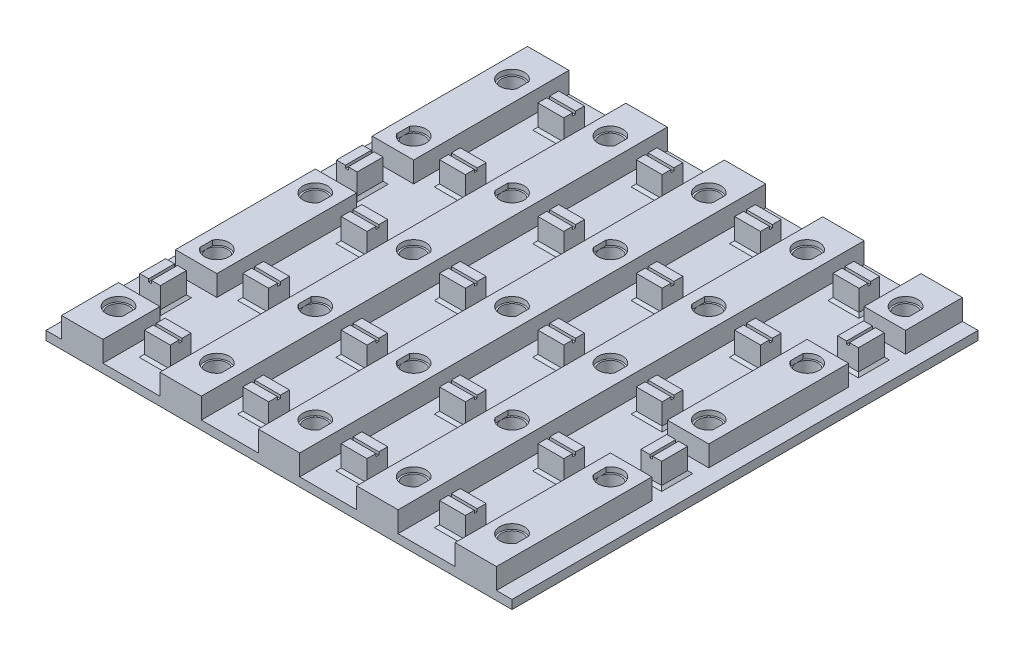
from build123d import *

# Parameters (mm, degrees)
SKETCH1_W            = 220
SKETCH1_H            = 220
BOSS_EXTRUDE1_DEPTH  = 11.4
SKETCH2_R            = 4.075
CUT_EXTRUDE1_DEPTH   = 11.5
CUT_EXTRUDE7_DEPTH   = 1.9
LPATTERN2_COUNT      = 5
LPATTERN2_PITCH      = 38
SKETCH11_W           = 22
SKETCH11_H           = 220
SKETCH11_W_2         = 10
SKETCH11_H_2         = 8
SKETCH11_W_3         = 26
CUT_EXTRUDE8_DEPTH   = 8
SKETCH12_W           = 10
SKETCH12_H           = 3.45
BOSS_EXTRUDE4_DEPTH  = 1.1
LPATTERN3_COUNT      = 5
LPATTERN3_PITCH      = 38
LPATTERN3_COUNT_DIR2 = 4
LPATTERN3_PITCH_DIR2 = 38
SKETCH14_W           = 16
SKETCH14_H           = 22
SKETCH14_W_2         = 8
SKETCH14_H_2         = 10
CUT_EXTRUDE9_DEPTH   = 8
SKETCH16_W           = 3.45
SKETCH16_H           = 10
BOSS_EXTRUDE5_DEPTH  = 1.1
CHAMFER3_SIZE        = 1
SKETCH17_W           = 20
SKETCH17_H           = 220
CUT_EXTRUDE10_DEPTH  = 156.829425976
SKETCH18_W           = 180
SKETCH18_H           = 20
CUT_EXTRUDE11_DEPTH  = 143.583168712


with BuildPart() as part:
    # Sketch1 → Boss-Extrude1 (new body)
    with BuildSketch(Plane(origin=(0, 0, 0), x_dir=(1, 0, 0), z_dir=(0, 1, 0))):
        Rectangle(SKETCH1_W, SKETCH1_H)
    extrude(amount=BOSS_EXTRUDE1_DEPTH)

    # Sketch2 → Cut-Extrude1 (cut)
    with BuildSketch(Plane(origin=(0, 11.4, 0), x_dir=(1, 0, 0), z_dir=(0, 1, 0))):
        with Locations(Location((-76, -76, 0), (0, 0, 270))):
            Circle(SKETCH2_R)
        with Locations(Location((-38, -76, 0), (0, 0, 270))):
            Circle(SKETCH2_R)
        with Locations(Location((0, -76, 0), (0, 0, 270))):
            Circle(SKETCH2_R)
        with Locations(Location((38, -76, 0), (0, 0, 270))):
            Circle(SKETCH2_R)
        with Locations(Location((76, -76, 0), (0, 0, 270))):
            Circle(SKETCH2_R)
        with Locations(Location((-76, -38, 0), (0, 0, 270))):
            Circle(SKETCH2_R)
        with Locations(Location((-38, -38, 0), (0, 0, 270))):
            Circle(SKETCH2_R)
        with Locations(Location((0, -38, 0), (0, 0, 270))):
            Circle(SKETCH2_R)
        with Locations(Location((38, -38, 0), (0, 0, 270))):
            Circle(SKETCH2_R)
        with Locations(Location((76, -38, 0), (0, 0, 270))):
            Circle(SKETCH2_R)
        with Locations(Location((-76, 0, 0), (0, 0, 270))):
            Circle(SKETCH2_R)
        with Locations(Location((-38, 0, 0), (0, 0, 270))):
            Circle(SKETCH2_R)
        with Locations(Location((0, 0, 0), (0, 0, 270))):
            Circle(SKETCH2_R)
        with Locations(Location((38, 0, 0), (0, 0, 270))):
            Circle(SKETCH2_R)
        with Locations(Location((76, 0, 0), (0, 0, 270))):
            Circle(SKETCH2_R)
        with Locations(Location((-76, 38, 0), (0, 0, 270))):
            Circle(SKETCH2_R)
        with Locations(Location((-38, 38, 0), (0, 0, 270))):
            Circle(SKETCH2_R)
        with Locations(Location((0, 38, 0), (0, 0, 270))):
            Circle(SKETCH2_R)
        with Locations(Location((38, 38, 0), (0, 0, 270))):
            Circle(SKETCH2_R)
        with Locations(Location((76, 38, 0), (0, 0, 270))):
            Circle(SKETCH2_R)
        with Locations(Location((-76, 76, 0), (0, 0, 270))):
            Circle(SKETCH2_R)
        with Locations(Location((-38, 76, 0), (0, 0, 270))):
            Circle(SKETCH2_R)
        with Locations(Location((0, 76, 0), (0, 0, 270))):
            Circle(SKETCH2_R)
        with Locations(Location((38, 76, 0), (0, 0, 270))):
            Circle(SKETCH2_R)
        with Locations(Location((76, 76, 0), (0, 0, 270))):
            Circle(SKETCH2_R)
    extrude(amount=-CUT_EXTRUDE1_DEPTH, mode=Mode.SUBTRACT)

    # Sketch10 → Cut-Extrude7 (cut)
    with BuildSketch(Plane(origin=(0, 11.4, 0), x_dir=(1, 0, 0), z_dir=(0, 1, 0))):
        with BuildLine():
            Line((-71.925, -78.440671014), (-71.925, -73.559328986))
            ThreePointArc((-71.925, -73.559328986), (-80.75, -76), (-71.925, -78.440671014))
        make_face()
        with BuildLine():
            Line((-71.925, -2.440671014), (-71.925, 2.440671014))
            ThreePointArc((-71.925, 2.440671014), (-80.75, 0), (-71.925, -2.440671014))
        make_face()
        with BuildLine():
            Line((-71.925, 73.559328986), (-71.925, 78.440671014))
            ThreePointArc((-71.925, 78.440671014), (-80.75, 76), (-71.925, 73.559328986))
        make_face()
        with BuildLine():
            Line((-80.075, -35.559328986), (-80.075, -40.440671014))
            ThreePointArc((-80.075, -40.440671014), (-71.25, -38), (-80.075, -35.559328986))
        make_face()
        with BuildLine():
            Line((-80.075, 40.440671014), (-80.075, 35.559328986))
            ThreePointArc((-80.075, 35.559328986), (-71.25, 38), (-80.075, 40.440671014))
        make_face()
    cut_extrude7 = extrude(amount=-CUT_EXTRUDE7_DEPTH, mode=Mode.SUBTRACT)

    # LPattern2: Cut-Extrude7 ×5
    with Locations(*[(i * LPATTERN2_PITCH, 0, 0) for i in range(1, LPATTERN2_COUNT)]):
        add(cut_extrude7, mode=Mode.SUBTRACT)

    # Sketch11 → Cut-Extrude8 (cut)
    # profile 1 of 6: a face of its own
    with BuildSketch(Plane(origin=(0, 11.4, 0), x_dir=(1, 0, 0), z_dir=(0, 1, 0))):
        with Locations((-57, 0)):
            Rectangle(SKETCH11_W, SKETCH11_H)
        with Locations((-57, -76)):
            Rectangle(SKETCH11_W_2, SKETCH11_H_2, mode=Mode.SUBTRACT)
        with Locations((-57, -38)):
            Rectangle(SKETCH11_W_2, SKETCH11_H_2, mode=Mode.SUBTRACT)
        with Locations((-57, 0)):
            Rectangle(SKETCH11_W_2, SKETCH11_H_2, mode=Mode.SUBTRACT)
        with Locations((-57, 38)):
            Rectangle(SKETCH11_W_2, SKETCH11_H_2, mode=Mode.SUBTRACT)
        with Locations((-57, 76)):
            Rectangle(SKETCH11_W_2, SKETCH11_H_2, mode=Mode.SUBTRACT)
    # profile 2 of 6: a face of its own
    with BuildSketch(Plane(origin=(0, 11.4, 0), x_dir=(1, 0, 0), z_dir=(0, 1, 0))):
        with Locations((-19, 0)):
            Rectangle(SKETCH11_W, SKETCH11_H)
        with Locations((-19, -76)):
            Rectangle(SKETCH11_W_2, SKETCH11_H_2, mode=Mode.SUBTRACT)
        with Locations((-19, -38)):
            Rectangle(SKETCH11_W_2, SKETCH11_H_2, mode=Mode.SUBTRACT)
        with Locations((-19, 0)):
            Rectangle(SKETCH11_W_2, SKETCH11_H_2, mode=Mode.SUBTRACT)
        with Locations((-19, 38)):
            Rectangle(SKETCH11_W_2, SKETCH11_H_2, mode=Mode.SUBTRACT)
        with Locations((-19, 76)):
            Rectangle(SKETCH11_W_2, SKETCH11_H_2, mode=Mode.SUBTRACT)
    # profile 3 of 6: a face of its own
    with BuildSketch(Plane(origin=(0, 11.4, 0), x_dir=(1, 0, 0), z_dir=(0, 1, 0))):
        with Locations((19, 0)):
            Rectangle(SKETCH11_W, SKETCH11_H)
        with Locations((19, -76)):
            Rectangle(SKETCH11_W_2, SKETCH11_H_2, mode=Mode.SUBTRACT)
        with Locations((19, -38)):
            Rectangle(SKETCH11_W_2, SKETCH11_H_2, mode=Mode.SUBTRACT)
        with Locations((19, 0)):
            Rectangle(SKETCH11_W_2, SKETCH11_H_2, mode=Mode.SUBTRACT)
        with Locations((19, 38)):
            Rectangle(SKETCH11_W_2, SKETCH11_H_2, mode=Mode.SUBTRACT)
        with Locations((19, 76)):
            Rectangle(SKETCH11_W_2, SKETCH11_H_2, mode=Mode.SUBTRACT)
    # profile 4 of 6: a face of its own
    with BuildSketch(Plane(origin=(0, 11.4, 0), x_dir=(1, 0, 0), z_dir=(0, 1, 0))):
        with Locations((57, 0)):
            Rectangle(SKETCH11_W, SKETCH11_H)
        with Locations((57, -76)):
            Rectangle(SKETCH11_W_2, SKETCH11_H_2, mode=Mode.SUBTRACT)
        with Locations((57, -38)):
            Rectangle(SKETCH11_W_2, SKETCH11_H_2, mode=Mode.SUBTRACT)
        with Locations((57, 0)):
            Rectangle(SKETCH11_W_2, SKETCH11_H_2, mode=Mode.SUBTRACT)
        with Locations((57, 38)):
            Rectangle(SKETCH11_W_2, SKETCH11_H_2, mode=Mode.SUBTRACT)
        with Locations((57, 76)):
            Rectangle(SKETCH11_W_2, SKETCH11_H_2, mode=Mode.SUBTRACT)
    # profile 5 of 6: a face of its own
    with BuildSketch(Plane(origin=(0, 11.4, 0), x_dir=(1, 0, 0), z_dir=(0, 1, 0))):
        with Locations((-97, 0)):
            Rectangle(SKETCH11_W_3, SKETCH11_H)
    # profile 6 of 6: a face of its own
    with BuildSketch(Plane(origin=(0, 11.4, 0), x_dir=(1, 0, 0), z_dir=(0, 1, 0))):
        with Locations((97, 0)):
            Rectangle(SKETCH11_W_3, SKETCH11_H)
    extrude(amount=-CUT_EXTRUDE8_DEPTH, mode=Mode.SUBTRACT)

    # Sketch12 → Boss-Extrude4 (add)
    with BuildSketch(Plane(origin=(0, 11.4, 0), x_dir=(1, 0, 0), z_dir=(0, 1, 0))):
        with Locations((57, -73.725)):
            Rectangle(SKETCH12_W, SKETCH12_H)
        with Locations((57, -78.275)):
            Rectangle(SKETCH12_W, SKETCH12_H)
    boss_extrude4 = extrude(amount=BOSS_EXTRUDE4_DEPTH)

    # LPattern3: Boss-Extrude4 5 × 4
    with Locations(*[(-j * LPATTERN3_PITCH_DIR2, 0, -i * LPATTERN3_PITCH) for i in range(LPATTERN3_COUNT) for j in range(LPATTERN3_COUNT_DIR2) if (i, j) != (0, 0)]):
        add(boss_extrude4)

    # Sketch14 → Cut-Extrude9 (cut)
    # profile 1 of 4: a face of its own
    with BuildSketch(Plane(origin=(0, 11.4, 0), x_dir=(1, 0, 0), z_dir=(0, 1, 0))):
        with Locations((76, 57)):
            Rectangle(SKETCH14_W, SKETCH14_H)
        with Locations((77.8, 57)):
            Rectangle(SKETCH14_W_2, SKETCH14_H_2, mode=Mode.SUBTRACT)
    # profile 2 of 4: a face of its own
    with BuildSketch(Plane(origin=(0, 11.4, 0), x_dir=(1, 0, 0), z_dir=(0, 1, 0))):
        with Locations((-76, 19)):
            Rectangle(SKETCH14_W, SKETCH14_H)
        with Locations((-77.8, 19)):
            Rectangle(SKETCH14_W_2, SKETCH14_H_2, mode=Mode.SUBTRACT)
    # profile 3 of 4: a face of its own
    with BuildSketch(Plane(origin=(0, 11.4, 0), x_dir=(1, 0, 0), z_dir=(0, 1, 0))):
        with Locations((76, -19)):
            Rectangle(SKETCH14_W, SKETCH14_H)
        with Locations((77.8, -19)):
            Rectangle(SKETCH14_W_2, SKETCH14_H_2, mode=Mode.SUBTRACT)
    # profile 4 of 4: a face of its own
    with BuildSketch(Plane(origin=(0, 11.4, 0), x_dir=(1, 0, 0), z_dir=(0, 1, 0))):
        with Locations((-76, -57)):
            Rectangle(SKETCH14_W, SKETCH14_H)
        with Locations((-77.8, -57)):
            Rectangle(SKETCH14_W_2, SKETCH14_H_2, mode=Mode.SUBTRACT)
    extrude(amount=-CUT_EXTRUDE9_DEPTH, mode=Mode.SUBTRACT)

    # Sketch16 → Boss-Extrude5 (add)
    with BuildSketch(Plane(origin=(0, 11.4, 0), x_dir=(1, 0, 0), z_dir=(0, 1, 0))):
        with Locations((75.525, 57)):
            Rectangle(SKETCH16_W, SKETCH16_H)
        with Locations((80.075, 57)):
            Rectangle(SKETCH16_W, SKETCH16_H)
        with Locations((-80.075, 19)):
            Rectangle(SKETCH16_W, SKETCH16_H)
        with Locations((-75.525, 19)):
            Rectangle(SKETCH16_W, SKETCH16_H)
        with Locations((75.525, -19)):
            Rectangle(SKETCH16_W, SKETCH16_H)
        with Locations((80.075, -19)):
            Rectangle(SKETCH16_W, SKETCH16_H)
        with Locations((-80.075, -57)):
            Rectangle(SKETCH16_W, SKETCH16_H)
        with Locations((-75.525, -57)):
            Rectangle(SKETCH16_W, SKETCH16_H)
    extrude(amount=BOSS_EXTRUDE5_DEPTH)

    # Chamfer3
    chamfer3_edges = [part.edges().sort_by_distance(p)[0] for p in [
        (77.8, 3.4, -62),
        (73.8, 3.4, -57),
        (77.8, 3.4, -52),
        (81.8, 3.4, -57),
        (-77.8, 3.4, -24),
        (-81.8, 3.4, -19),
        (-77.8, 3.4, -14),
        (-73.8, 3.4, -19),
        (77.8, 3.4, 14),
        (73.8, 3.4, 19),
        (77.8, 3.4, 24),
        (81.8, 3.4, 19),
        (-77.8, 3.4, 52),
        (-81.8, 3.4, 57),
        (-77.8, 3.4, 62),
        (-73.8, 3.4, 57),
        (-19, 3.4, -80),
        (-19, 3.4, -42),
        (-19, 3.4, -4),
        (-19, 3.4, 34),
        (-19, 3.4, 72),
        (-14, 3.4, -76),
        (-14, 3.4, -38),
        (-14, 3.4, 0),
        (-14, 3.4, 38),
        (-14, 3.4, 76),
        (-24, 3.4, 76),
        (-19, 3.4, 80),
        (-24, 3.4, 38),
        (-19, 3.4, 42),
        (-24, 3.4, 0),
        (-19, 3.4, 4),
        (-24, 3.4, -38),
        (-19, 3.4, -34),
        (-24, 3.4, -76),
        (-19, 3.4, -72),
        (19, 3.4, -80),
        (19, 3.4, -42),
        (19, 3.4, -4),
        (19, 3.4, 34),
        (19, 3.4, 72),
        (24, 3.4, -76),
        (24, 3.4, -38),
        (24, 3.4, 0),
        (24, 3.4, 38),
        (24, 3.4, 76),
        (14, 3.4, 76),
        (19, 3.4, 80),
        (14, 3.4, 38),
        (19, 3.4, 42),
        (14, 3.4, 0),
        (19, 3.4, 4),
        (14, 3.4, -38),
        (19, 3.4, -34),
        (14, 3.4, -76),
        (19, 3.4, -72),
        (57, 3.4, -80),
        (57, 3.4, -42),
        (57, 3.4, -4),
        (57, 3.4, 34),
        (57, 3.4, 72),
        (62, 3.4, -76),
        (62, 3.4, -38),
        (62, 3.4, 0),
        (62, 3.4, 38),
        (62, 3.4, 76),
        (52, 3.4, 76),
        (57, 3.4, 80),
        (52, 3.4, 38),
        (57, 3.4, 42),
        (52, 3.4, 0),
        (57, 3.4, 4),
        (52, 3.4, -38),
        (57, 3.4, -34),
        (52, 3.4, -76),
        (57, 3.4, -72),
        (-57, 3.4, -80),
        (-57, 3.4, -42),
        (-57, 3.4, -4),
        (-57, 3.4, 34),
        (-57, 3.4, 72),
        (-52, 3.4, -76),
        (-52, 3.4, -38),
        (-52, 3.4, 0),
        (-52, 3.4, 38),
        (-52, 3.4, 76),
        (-62, 3.4, 76),
        (-57, 3.4, 80),
        (-62, 3.4, 38),
        (-57, 3.4, 42),
        (-62, 3.4, 0),
        (-57, 3.4, 4),
        (-62, 3.4, -38),
        (-57, 3.4, -34),
        (-62, 3.4, -76),
        (-57, 3.4, -72),
    ]]
    chamfer(chamfer3_edges, length=CHAMFER3_SIZE)

    # Sketch17 → Cut-Extrude10 (cut, through all)
    with BuildSketch(Plane(origin=(0, 3.4, 0), x_dir=(1, 0, 0), z_dir=(0, 1, 0))):
        with Locations((-100, 0)):
            Rectangle(SKETCH17_W, SKETCH17_H)
        with Locations((100, 0)):
            Rectangle(SKETCH17_W, SKETCH17_H)
    extrude(amount=-CUT_EXTRUDE10_DEPTH, mode=Mode.SUBTRACT)

    # Sketch18 → Cut-Extrude11 (cut, through all)
    with BuildSketch(Plane(origin=(0, 11.4, 0), x_dir=(1, 0, 0), z_dir=(0, 1, 0))):
        with Locations((0, 100)):
            Rectangle(SKETCH18_W, SKETCH18_H)
        with Locations((0, -100)):
            Rectangle(SKETCH18_W, SKETCH18_H)
    extrude(amount=-CUT_EXTRUDE11_DEPTH, mode=Mode.SUBTRACT)


solid = part.part
